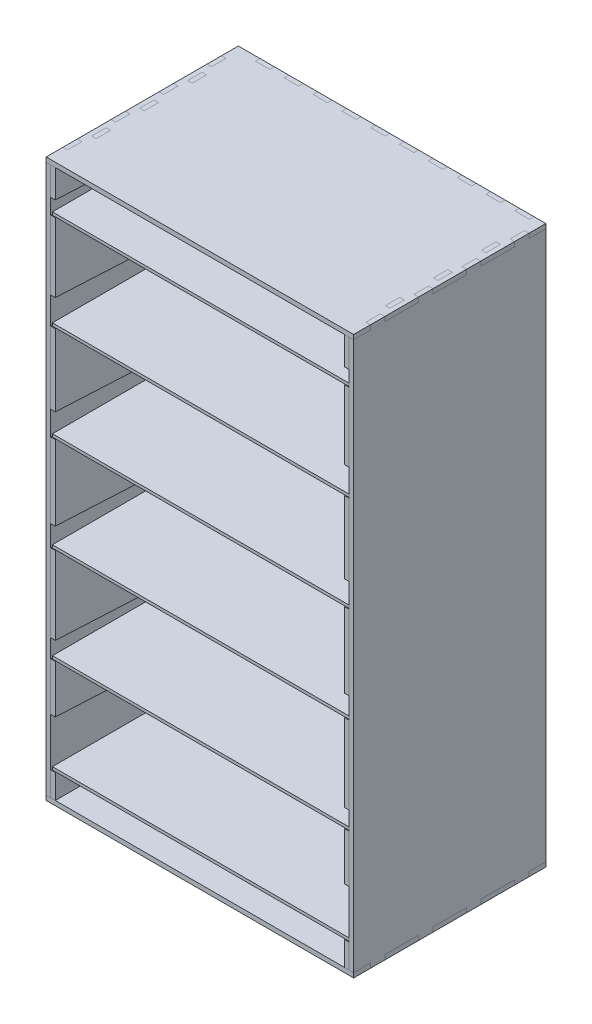
from build123d import *

# Parameters (mm, degrees)
BOSS_EXTRUDE2_START = 290
SKETCH3_W           = 4.75
SKETCH3_H           = 15
BOSS_EXTRUDE2_DEPTH = 4.75
BOSS_EXTRUDE3_START = 160
BOSS_EXTRUDE3_DEPTH = 4.75
BOSS_EXTRUDE4_START = -155.25
BOSS_EXTRUDE4_DEPTH = 4.75
CHAMFER3_SIZE       = 10
CHAMFER3_SIZE_2     = 200
BOSS_EXTRUDE5_DEPTH = 4.75
BOSS_EXTRUDE6_START = -260
SKETCH7_W           = 299.5
SKETCH7_H           = 193.75
SKETCH7_W_2         = 4.5
SKETCH7_H_2         = 169.25
BOSS_EXTRUDE6_DEPTH = 3
LPATTERN1_COUNT     = 6
LPATTERN1_PITCH     = 100


with BuildPart() as part:
    # Sketch3 → Boss-Extrude2 (new body)
    with BuildSketch(Plane(origin=(0, 0, 0), x_dir=(1, 0, 0), z_dir=(0, 1, 0)).offset(BOSS_EXTRUDE2_START)):
        Polygon((-137.5, 0), (-160, 0), (-160, -17.5), (-155.25, -17.5), (-155.25, -32.5), (-160, -32.5), (-160, -67.5), (-155.25, -67.5), (-155.25, -82.5), (-160, -82.5), (-160, -117.5), (-155.25, -117.5), (-155.25, -132.5), (-160, -132.5), (-160, -167.5), (-155.25, -167.5), (-155.25, -182.5), (-160, -182.5), (-160, -200), (160, -200), (160, -182.5), (155.25, -182.5), (155.25, -167.5), (160, -167.5), (160, -132.5), (155.25, -132.5), (155.25, -117.5), (160, -117.5), (160, -82.5), (155.25, -82.5), (155.25, -67.5), (160, -67.5), (160, -32.5), (155.25, -32.5), (155.25, -17.5), (160, -17.5), (160, 0), (147.5, 0), (147.5, -4.75), (132.5, -4.75), (132.5, 0), (117.5, 0), (117.5, -4.75), (102.5, -4.75), (102.5, 0), (87.5, 0), (87.5, -4.75), (72.5, -4.75), (72.5, 0), (57.5, 0), (57.5, -4.75), (42.5, -4.75), (42.5, 0), (27.5, 0), (27.5, -4.75), (12.5, -4.75), (12.5, 0), (-2.5, 0), (-2.5, -4.75), (-17.5, -4.75), (-17.5, 0), (-32.5, 0), (-32.5, -4.75), (-47.5, -4.75), (-47.5, 0), (-62.5, 0), (-62.5, -4.75), (-77.5, -4.75), (-77.5, 0), (-92.5, 0), (-92.5, -4.75), (-107.5, -4.75), (-107.5, 0), (-122.5, 0), (-122.5, -4.75), (-137.5, -4.75), align=None)
        with Locations((-152.875, -150)):
            Rectangle(SKETCH3_W, SKETCH3_H, mode=Mode.SUBTRACT)
        with Locations((152.875, -150)):
            Rectangle(SKETCH3_W, SKETCH3_H, mode=Mode.SUBTRACT)
        with Locations((-152.875, -100)):
            Rectangle(SKETCH3_W, SKETCH3_H, mode=Mode.SUBTRACT)
        with Locations((-152.875, -50)):
            Rectangle(SKETCH3_W, SKETCH3_H, mode=Mode.SUBTRACT)
        with Locations((152.875, -100)):
            Rectangle(SKETCH3_W, SKETCH3_H, mode=Mode.SUBTRACT)
        with Locations((152.875, -50)):
            Rectangle(SKETCH3_W, SKETCH3_H, mode=Mode.SUBTRACT)
    extrude(amount=-BOSS_EXTRUDE2_DEPTH)


with BuildPart() as body_2:
    # Mirror2: mirrored copy
    add(part.part.mirror(Plane.ZX))


with BuildPart() as body_3:
    # Sketch4 → Boss-Extrude3 (new body)
    with BuildSketch(Plane(origin=(0, 0, 0), x_dir=(0, 0, -1), z_dir=(1, 0, 0)).offset(BOSS_EXTRUDE3_START)):
        Polygon((-32.5, -290), (-17.5, -290), (-17.5, -285.25), (0, -285.25), (0, 285.25), (-17.5, 285.25), (-17.5, 290), (-32.5, 290), (-32.5, 285.25), (-67.5, 285.25), (-67.5, 290), (-82.5, 290), (-82.5, 285.25), (-117.5, 285.25), (-117.5, 290), (-132.5, 290), (-132.5, 285.25), (-167.5, 285.25), (-167.5, 290), (-182.5, 290), (-182.5, 285.25), (-200, 285.25), (-200, -285.25), (-182.5, -285.25), (-182.5, -290), (-167.5, -290), (-167.5, -285.25), (-132.5, -285.25), (-132.5, -290), (-117.5, -290), (-117.5, -285.25), (-82.5, -285.25), (-82.5, -290), (-67.5, -290), (-67.5, -285.25), (-32.5, -285.25), align=None)
    extrude(amount=-BOSS_EXTRUDE3_DEPTH)


with BuildPart() as body_4:
    # Mirror3: mirrored copy
    add(body_3.part.mirror(Plane(origin=(0, 0, 0), x_dir=(0, 0, 1), z_dir=(1, 0, 0))))


with BuildPart() as body_5:
    # Sketch5 → Boss-Extrude4 (new body)
    with BuildSketch(Plane(origin=(0, 0, 0), x_dir=(0, 0, -1), z_dir=(1, 0, 0)).offset(BOSS_EXTRUDE4_START)):
        Polygon((-42.5, -285.25), (-4.75, -285.25), (-4.75, 285.25), (-42.5, 285.25), (-42.5, 290), (-57.5, 290), (-57.5, 285.25), (-92.5, 285.25), (-92.5, 290), (-107.5, 290), (-107.5, 285.25), (-142.5, 285.25), (-142.5, 290), (-157.5, 290), (-157.5, 285.25), (-200, 285.25), (-200, 246), (-30, 246), (-30, 240), (-200, 240), (-200, 158), (-30, 158), (-30, 140), (-200, 140), (-200, 55), (-30, 55), (-30, 40), (-200, 40), (-200, -48), (-30, -48), (-30, -60), (-200, -60), (-200, -151), (-30, -151), (-30, -160), (-200, -160), (-200, -220), (-30, -220), (-30, -260), (-200, -260), (-200, -285.25), (-157.5, -285.25), (-157.5, -290), (-142.5, -290), (-142.5, -285.25), (-107.5, -285.25), (-107.5, -290), (-92.5, -290), (-92.5, -285.25), (-57.5, -285.25), (-57.5, -290), (-42.5, -290), align=None)
    extrude(amount=BOSS_EXTRUDE4_DEPTH)

    # Chamfer3
    # the kernel refuses this chamfer: 200, 10 mm, written as the material it takes off along each edge
    with BuildSketch(Plane(origin=(-675.226005963, 246, 200), x_dir=(0, 0.7929775212959712, 0.6092508930804267), z_dir=(1, 0, 0))) as chamfer3_piece_1_section:
        Polygon((CHAMFER3_SIZE * 0.792977521296, -CHAMFER3_SIZE * 0.60925089308), (-CHAMFER3_SIZE_2 * 0.60925089308, -CHAMFER3_SIZE_2 * 0.792977521296), (0, 0), align=None)
    chamfer3_piece_1 = extrude(amount=1044.702011927, mode=Mode.PRIVATE)
    chamfer3_piece_1 = split(chamfer3_piece_1, bisect_by=Plane(origin=(-152.875, 247.298440314, 30), z_dir=(0, 0, 1)), keep=Keep.TOP, mode=Mode.PRIVATE)
    add(chamfer3_piece_1, mode=Mode.SUBTRACT)
    with BuildSketch(Plane(origin=(-675.226005963, 158, 200), x_dir=(0, 0.7929775212959712, 0.6092508930804267), z_dir=(1, 0, 0))) as chamfer3_piece_2_section:
        Polygon((CHAMFER3_SIZE * 0.792977521296, -CHAMFER3_SIZE * 0.60925089308), (-CHAMFER3_SIZE_2 * 0.60925089308, -CHAMFER3_SIZE_2 * 0.792977521296), (0, 0), align=None)
    chamfer3_piece_2 = extrude(amount=1044.702011927, mode=Mode.PRIVATE)
    chamfer3_piece_2 = split(chamfer3_piece_2, bisect_by=Plane(origin=(-152.875, 159.298440314, 30), z_dir=(0, 0, 1)), keep=Keep.TOP, mode=Mode.PRIVATE)
    add(chamfer3_piece_2, mode=Mode.SUBTRACT)
    with BuildSketch(Plane(origin=(-675.226005963, 55, 200), x_dir=(0, 0.7929775212959708, 0.6092508930804271), z_dir=(1, 0, 0))) as chamfer3_piece_3_section:
        Polygon((CHAMFER3_SIZE * 0.792977521296, -CHAMFER3_SIZE * 0.60925089308), (-CHAMFER3_SIZE_2 * 0.60925089308, -CHAMFER3_SIZE_2 * 0.792977521296), (0, 0), align=None)
    chamfer3_piece_3 = extrude(amount=1044.702011927, mode=Mode.PRIVATE)
    chamfer3_piece_3 = split(chamfer3_piece_3, bisect_by=Plane(origin=(-152.875, 56.298440314, 30), z_dir=(0, 0, 1)), keep=Keep.TOP, mode=Mode.PRIVATE)
    add(chamfer3_piece_3, mode=Mode.SUBTRACT)
    with BuildSketch(Plane(origin=(-675.226005963, -48, 200), x_dir=(0, 0.792977521295971, 0.6092508930804269), z_dir=(1, 0, 0))) as chamfer3_piece_4_section:
        Polygon((CHAMFER3_SIZE * 0.792977521296, -CHAMFER3_SIZE * 0.60925089308), (-CHAMFER3_SIZE_2 * 0.60925089308, -CHAMFER3_SIZE_2 * 0.792977521296), (0, 0), align=None)
    chamfer3_piece_4 = extrude(amount=1044.702011927, mode=Mode.PRIVATE)
    chamfer3_piece_4 = split(chamfer3_piece_4, bisect_by=Plane(origin=(-152.875, -46.701559686, 30), z_dir=(0, 0, 1)), keep=Keep.TOP, mode=Mode.PRIVATE)
    add(chamfer3_piece_4, mode=Mode.SUBTRACT)
    with BuildSketch(Plane(origin=(-675.226005963, -151, 200), x_dir=(0, 0.7929775212959712, 0.6092508930804267), z_dir=(1, 0, 0))) as chamfer3_piece_5_section:
        Polygon((CHAMFER3_SIZE * 0.792977521296, -CHAMFER3_SIZE * 0.60925089308), (-CHAMFER3_SIZE_2 * 0.60925089308, -CHAMFER3_SIZE_2 * 0.792977521296), (0, 0), align=None)
    chamfer3_piece_5 = extrude(amount=1044.702011927, mode=Mode.PRIVATE)
    chamfer3_piece_5 = split(chamfer3_piece_5, bisect_by=Plane(origin=(-152.875, -149.701559686, 30), z_dir=(0, 0, 1)), keep=Keep.TOP, mode=Mode.PRIVATE)
    add(chamfer3_piece_5, mode=Mode.SUBTRACT)
    with BuildSketch(Plane(origin=(-675.226005963, -220, 200), x_dir=(0, 0.7929775212959712, 0.6092508930804267), z_dir=(1, 0, 0))) as chamfer3_piece_6_section:
        Polygon((CHAMFER3_SIZE * 0.792977521296, -CHAMFER3_SIZE * 0.60925089308), (-CHAMFER3_SIZE_2 * 0.60925089308, -CHAMFER3_SIZE_2 * 0.792977521296), (0, 0), align=None)
    chamfer3_piece_6 = extrude(amount=1044.702011927, mode=Mode.PRIVATE)
    chamfer3_piece_6 = split(chamfer3_piece_6, bisect_by=Plane(origin=(-152.875, -218.701559686, 30), z_dir=(0, 0, 1)), keep=Keep.TOP, mode=Mode.PRIVATE)
    add(chamfer3_piece_6, mode=Mode.SUBTRACT)


with BuildPart() as body_6:
    # Mirror4: mirrored copy
    add(body_5.part.mirror(Plane(origin=(0, 0, 0), x_dir=(0, 0, 1), z_dir=(1, 0, 0))))


with BuildPart() as body_7:
    # Sketch6 → Boss-Extrude5 (new body)
    with BuildSketch(Plane.XY):
        Polygon((155.25, -285.25), (155.25, 285.25), (147.5, 285.25), (147.5, 290), (132.5, 290), (132.5, 285.25), (117.5, 285.25), (117.5, 290), (102.5, 290), (102.5, 285.25), (87.5, 285.25), (87.5, 290), (72.5, 290), (72.5, 285.25), (57.5, 285.25), (57.5, 290), (42.5, 290), (42.5, 285.25), (27.5, 285.25), (27.5, 290), (12.5, 290), (12.5, 285.25), (-2.5, 285.25), (-2.5, 290), (-17.5, 290), (-17.5, 285.25), (-32.5, 285.25), (-32.5, 290), (-47.5, 290), (-47.5, 285.25), (-62.5, 285.25), (-62.5, 290), (-77.5, 290), (-77.5, 285.25), (-92.5, 285.25), (-92.5, 290), (-107.5, 290), (-107.5, 285.25), (-122.5, 285.25), (-122.5, 290), (-137.5, 290), (-137.5, 285.25), (-155.25, 285.25), (-155.25, -285.25), (-137.5, -285.25), (-137.5, -290), (-122.5, -290), (-122.5, -285.25), (-107.5, -285.25), (-107.5, -290), (-92.5, -290), (-92.5, -285.25), (-77.5, -285.25), (-77.5, -290), (-62.5, -290), (-62.5, -285.25), (-47.5, -285.25), (-47.5, -290), (-32.5, -290), (-32.5, -285.25), (-17.5, -285.25), (-17.5, -290), (-2.5, -290), (-2.5, -285.25), (12.5, -285.25), (12.5, -290), (27.5, -290), (27.5, -285.25), (42.5, -285.25), (42.5, -290), (57.5, -290), (57.5, -285.25), (72.5, -285.25), (72.5, -290), (87.5, -290), (87.5, -285.25), (102.5, -285.25), (102.5, -290), (117.5, -290), (117.5, -285.25), (132.5, -285.25), (132.5, -290), (147.5, -290), (147.5, -285.25), align=None)
    extrude(amount=BOSS_EXTRUDE5_DEPTH)


with BuildPart() as body_8:
    # Sketch7 → Boss-Extrude6 (new body)
    with BuildSketch(Plane(origin=(0, 0, 0), x_dir=(1, 0, 0), z_dir=(0, 1, 0)).offset(BOSS_EXTRUDE6_START)):
        with Locations((0, -102.375)):
            Rectangle(SKETCH7_W, SKETCH7_H)
        with Locations((-152, -114.625)):
            Rectangle(SKETCH7_W_2, SKETCH7_H_2)
        with Locations((152, -114.625)):
            Rectangle(SKETCH7_W_2, SKETCH7_H_2)
    extrude(amount=BOSS_EXTRUDE6_DEPTH)


with BuildPart() as lpattern1_1:
    # LPattern1: pattern copy
    add(body_8.part.moved(Location(Vector(0, 1, 0) * (1 * LPATTERN1_PITCH))))


with BuildPart() as lpattern1_2:
    # LPattern1: pattern copy
    add(body_8.part.moved(Location(Vector(0, 1, 0) * (2 * LPATTERN1_PITCH))))


with BuildPart() as lpattern1_3:
    # LPattern1: pattern copy
    add(body_8.part.moved(Location(Vector(0, 1, 0) * (3 * LPATTERN1_PITCH))))


with BuildPart() as lpattern1_4:
    # LPattern1: pattern copy
    add(body_8.part.moved(Location(Vector(0, 1, 0) * (4 * LPATTERN1_PITCH))))


with BuildPart() as lpattern1_5:
    # LPattern1: pattern copy
    add(body_8.part.moved(Location(Vector(0, 1, 0) * (5 * LPATTERN1_PITCH))))


solid = Compound([part.part, body_2.part, body_3.part, body_4.part, body_5.part, body_6.part, body_7.part, body_8.part, lpattern1_1.part, lpattern1_2.part, lpattern1_3.part, lpattern1_4.part, lpattern1_5.part])
